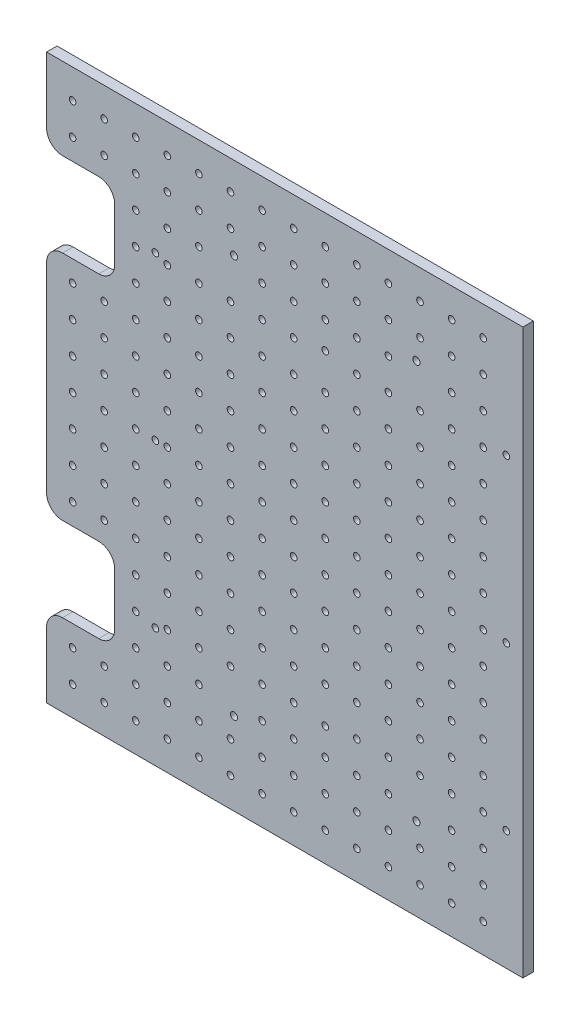
from build123d import *

# Parameters (mm, degrees)
SKETCH1_W                            = 287.27
SKETCH1_H                            = 340
BASE_PLATE_EXTRUDE_DEPTH             = 6.3
SKETCH3_R                            = 2
SKETCH3_R_2                          = 2.15
PLATE_TO_PLATE_MNT_THRU_HOLE_DEPTH   = 223.644791596
SKETCH4_R                            = 2
CENTER_PERFORATION_THRU_HOLE_DEPTH   = 223.644791596
SKETCH6_R                            = 2
EXTENDED_PERFORATION_THRU_HOLE_DEPTH = 223.644791596
CABLE_ROUTING_CUTOUT_DEPTH           = 223.644791596


with BuildPart() as part:
    # Sketch1 → Base_Plate-Extrude (new body)
    with BuildSketch(Plane.XY):
        Rectangle(SKETCH1_W, SKETCH1_H)
    extrude(amount=BASE_PLATE_EXTRUDE_DEPTH)

    # Sketch3 → Plate_to_Plate_Mnt-Thru-Hole (cut, through all)
    with BuildSketch(Plane.XY.offset(6.3)):
        with Locations((133.635, 98)):
            Circle(SKETCH3_R)
        with Locations((24.415, 98)):
            Circle(SKETCH3_R)
        with Locations((-78.025, 98)):
            Circle(SKETCH3_R)
        with Locations((-78.025, -98)):
            Circle(SKETCH3_R)
        with Locations((24.415, -98)):
            Circle(SKETCH3_R)
        with Locations((133.635, -98)):
            Circle(SKETCH3_R)
        with Locations((133.635, 0)):
            Circle(SKETCH3_R)
        with Locations((-78.025, 0)):
            Circle(SKETCH3_R)
        with Locations((79.415, -120.25)):
            Circle(SKETCH3_R_2)
        with Locations((-30.585, -120.25)):
            Circle(SKETCH3_R_2)
        with Locations((-30.585, 120.25)):
            Circle(SKETCH3_R_2)
        with Locations((79.415, 120.25)):
            Circle(SKETCH3_R_2)
    extrude(amount=-PLATE_TO_PLATE_MNT_THRU_HOLE_DEPTH, mode=Mode.SUBTRACT)

    # Sketch4 → Center_Perforation-Thru-Hole (cut, through all)
    with BuildSketch(Plane.XY.offset(6.3)):
        with Locations((-70.835, 0)):
            Circle(SKETCH4_R)
        with Locations((-51.785, 0)):
            Circle(SKETCH4_R)
        with Locations((-32.735, 0)):
            Circle(SKETCH4_R)
        with Locations((-13.685, 0)):
            Circle(SKETCH4_R)
        with Locations((5.365, 0)):
            Circle(SKETCH4_R)
        with Locations((24.415, 0)):
            Circle(SKETCH4_R)
        with Locations((43.465, 0)):
            Circle(SKETCH4_R)
        with Locations((62.515, 0)):
            Circle(SKETCH4_R)
        with Locations((81.565, 0)):
            Circle(SKETCH4_R)
        with Locations((100.615, 0)):
            Circle(SKETCH4_R)
        with Locations((119.665, 0)):
            Circle(SKETCH4_R)
        with Locations((-70.835, 19.05)):
            Circle(SKETCH4_R)
        with Locations((-51.785, 19.05)):
            Circle(SKETCH4_R)
        with Locations((-32.735, 19.05)):
            Circle(SKETCH4_R)
        with Locations((-13.685, 19.05)):
            Circle(SKETCH4_R)
        with Locations((5.365, 19.05)):
            Circle(SKETCH4_R)
        with Locations((24.415, 19.05)):
            Circle(SKETCH4_R)
        with Locations((43.465, 19.05)):
            Circle(SKETCH4_R)
        with Locations((62.515, 19.05)):
            Circle(SKETCH4_R)
        with Locations((81.565, 19.05)):
            Circle(SKETCH4_R)
        with Locations((100.615, 19.05)):
            Circle(SKETCH4_R)
        with Locations((119.665, 19.05)):
            Circle(SKETCH4_R)
        with Locations((-70.835, 38.1)):
            Circle(SKETCH4_R)
        with Locations((-51.785, 38.1)):
            Circle(SKETCH4_R)
        with Locations((-32.735, 38.1)):
            Circle(SKETCH4_R)
        with Locations((-13.685, 38.1)):
            Circle(SKETCH4_R)
        with Locations((5.365, 38.1)):
            Circle(SKETCH4_R)
        with Locations((24.415, 38.1)):
            Circle(SKETCH4_R)
        with Locations((43.465, 38.1)):
            Circle(SKETCH4_R)
        with Locations((62.515, 38.1)):
            Circle(SKETCH4_R)
        with Locations((81.565, 38.1)):
            Circle(SKETCH4_R)
        with Locations((100.615, 38.1)):
            Circle(SKETCH4_R)
        with Locations((119.665, 38.1)):
            Circle(SKETCH4_R)
        with Locations((-70.835, 57.15)):
            Circle(SKETCH4_R)
        with Locations((-51.785, 57.15)):
            Circle(SKETCH4_R)
        with Locations((-32.735, 57.15)):
            Circle(SKETCH4_R)
        with Locations((-13.685, 57.15)):
            Circle(SKETCH4_R)
        with Locations((5.365, 57.15)):
            Circle(SKETCH4_R)
        with Locations((24.415, 57.15)):
            Circle(SKETCH4_R)
        with Locations((43.465, 57.15)):
            Circle(SKETCH4_R)
        with Locations((62.515, 57.15)):
            Circle(SKETCH4_R)
        with Locations((81.565, 57.15)):
            Circle(SKETCH4_R)
        with Locations((100.615, 57.15)):
            Circle(SKETCH4_R)
        with Locations((119.665, 57.15)):
            Circle(SKETCH4_R)
        with Locations((-70.835, -19.05)):
            Circle(SKETCH4_R)
        with Locations((-51.785, -19.05)):
            Circle(SKETCH4_R)
        with Locations((-32.735, -19.05)):
            Circle(SKETCH4_R)
        with Locations((-13.685, -19.05)):
            Circle(SKETCH4_R)
        with Locations((5.365, -19.05)):
            Circle(SKETCH4_R)
        with Locations((24.415, -19.05)):
            Circle(SKETCH4_R)
        with Locations((43.465, -19.05)):
            Circle(SKETCH4_R)
        with Locations((62.515, -19.05)):
            Circle(SKETCH4_R)
        with Locations((81.565, -19.05)):
            Circle(SKETCH4_R)
        with Locations((100.615, -19.05)):
            Circle(SKETCH4_R)
        with Locations((119.665, -19.05)):
            Circle(SKETCH4_R)
        with Locations((-70.835, -38.1)):
            Circle(SKETCH4_R)
        with Locations((-51.785, -38.1)):
            Circle(SKETCH4_R)
        with Locations((-32.735, -38.1)):
            Circle(SKETCH4_R)
        with Locations((-13.685, -38.1)):
            Circle(SKETCH4_R)
        with Locations((5.365, -38.1)):
            Circle(SKETCH4_R)
        with Locations((24.415, -38.1)):
            Circle(SKETCH4_R)
        with Locations((43.465, -38.1)):
            Circle(SKETCH4_R)
        with Locations((62.515, -38.1)):
            Circle(SKETCH4_R)
        with Locations((81.565, -38.1)):
            Circle(SKETCH4_R)
        with Locations((100.615, -38.1)):
            Circle(SKETCH4_R)
        with Locations((119.665, -38.1)):
            Circle(SKETCH4_R)
        with Locations((-70.835, -57.15)):
            Circle(SKETCH4_R)
        with Locations((-51.785, -57.15)):
            Circle(SKETCH4_R)
        with Locations((-32.735, -57.15)):
            Circle(SKETCH4_R)
        with Locations((-13.685, -57.15)):
            Circle(SKETCH4_R)
        with Locations((5.365, -57.15)):
            Circle(SKETCH4_R)
        with Locations((24.415, -57.15)):
            Circle(SKETCH4_R)
        with Locations((43.465, -57.15)):
            Circle(SKETCH4_R)
        with Locations((62.515, -57.15)):
            Circle(SKETCH4_R)
        with Locations((81.565, -57.15)):
            Circle(SKETCH4_R)
        with Locations((100.615, -57.15)):
            Circle(SKETCH4_R)
        with Locations((119.665, -57.15)):
            Circle(SKETCH4_R)
    extrude(amount=-CENTER_PERFORATION_THRU_HOLE_DEPTH, mode=Mode.SUBTRACT)

    # Sketch6 → Extended_Perforation-Thru-Hole (cut, through all)
    with BuildSketch(Plane.XY.offset(6.3)):
        with Locations((-89.885, 0)):
            Circle(SKETCH6_R)
        with Locations((-51.785, -95.25)):
            Circle(SKETCH6_R)
        with Locations((-70.835, -95.25)):
            Circle(SKETCH6_R)
        with Locations((-108.935, 0)):
            Circle(SKETCH6_R)
        with Locations((-127.985, 0)):
            Circle(SKETCH6_R)
        with Locations((-89.885, 19.05)):
            Circle(SKETCH6_R)
        with Locations((-108.935, 19.05)):
            Circle(SKETCH6_R)
        with Locations((-127.985, 19.05)):
            Circle(SKETCH6_R)
        with Locations((-89.885, 38.1)):
            Circle(SKETCH6_R)
        with Locations((-108.935, 38.1)):
            Circle(SKETCH6_R)
        with Locations((-127.985, 38.1)):
            Circle(SKETCH6_R)
        with Locations((-89.885, 57.15)):
            Circle(SKETCH6_R)
        with Locations((-108.935, 57.15)):
            Circle(SKETCH6_R)
        with Locations((-127.985, 57.15)):
            Circle(SKETCH6_R)
        with Locations((-89.885, 76.2)):
            Circle(SKETCH6_R)
        with Locations((-108.935, 76.2)):
            Circle(SKETCH6_R)
        with Locations((-127.985, 76.2)):
            Circle(SKETCH6_R)
        with Locations((-89.885, 95.25)):
            Circle(SKETCH6_R)
        with Locations((-108.935, 95.25)):
            Circle(SKETCH6_R)
        with Locations((-127.985, 95.25)):
            Circle(SKETCH6_R)
        with Locations((-89.885, 114.3)):
            Circle(SKETCH6_R)
        with Locations((-108.935, 114.3)):
            Circle(SKETCH6_R)
        with Locations((-127.985, 114.3)):
            Circle(SKETCH6_R)
        with Locations((-89.885, 133.35)):
            Circle(SKETCH6_R)
        with Locations((-108.935, 133.35)):
            Circle(SKETCH6_R)
        with Locations((-127.985, 133.35)):
            Circle(SKETCH6_R)
        with Locations((-89.885, 152.4)):
            Circle(SKETCH6_R)
        with Locations((-108.935, 152.4)):
            Circle(SKETCH6_R)
        with Locations((-127.985, 152.4)):
            Circle(SKETCH6_R)
        with Locations((-89.885, -19.05)):
            Circle(SKETCH6_R)
        with Locations((-108.935, -19.05)):
            Circle(SKETCH6_R)
        with Locations((-127.985, -19.05)):
            Circle(SKETCH6_R)
        with Locations((-89.885, -38.1)):
            Circle(SKETCH6_R)
        with Locations((-108.935, -38.1)):
            Circle(SKETCH6_R)
        with Locations((-127.985, -38.1)):
            Circle(SKETCH6_R)
        with Locations((-89.885, -57.15)):
            Circle(SKETCH6_R)
        with Locations((-108.935, -57.15)):
            Circle(SKETCH6_R)
        with Locations((-127.985, -57.15)):
            Circle(SKETCH6_R)
        with Locations((-89.885, -76.2)):
            Circle(SKETCH6_R)
        with Locations((-108.935, -76.2)):
            Circle(SKETCH6_R)
        with Locations((-127.985, -76.2)):
            Circle(SKETCH6_R)
        with Locations((-89.885, -95.25)):
            Circle(SKETCH6_R)
        with Locations((-108.935, -95.25)):
            Circle(SKETCH6_R)
        with Locations((-127.985, -95.25)):
            Circle(SKETCH6_R)
        with Locations((-89.885, -114.3)):
            Circle(SKETCH6_R)
        with Locations((-108.935, -114.3)):
            Circle(SKETCH6_R)
        with Locations((-127.985, -114.3)):
            Circle(SKETCH6_R)
        with Locations((-89.885, -133.35)):
            Circle(SKETCH6_R)
        with Locations((-108.935, -133.35)):
            Circle(SKETCH6_R)
        with Locations((-127.985, -133.35)):
            Circle(SKETCH6_R)
        with Locations((-89.885, -152.4)):
            Circle(SKETCH6_R)
        with Locations((-108.935, -152.4)):
            Circle(SKETCH6_R)
        with Locations((-127.985, -152.4)):
            Circle(SKETCH6_R)
        with Locations((-51.785, -114.3)):
            Circle(SKETCH6_R)
        with Locations((-70.835, -114.3)):
            Circle(SKETCH6_R)
        with Locations((119.665, -76.2)):
            Circle(SKETCH6_R)
        with Locations((100.615, -76.2)):
            Circle(SKETCH6_R)
        with Locations((119.665, -95.25)):
            Circle(SKETCH6_R)
        with Locations((100.615, -95.25)):
            Circle(SKETCH6_R)
        with Locations((119.665, -114.3)):
            Circle(SKETCH6_R)
        with Locations((100.615, -114.3)):
            Circle(SKETCH6_R)
        with Locations((119.665, -133.35)):
            Circle(SKETCH6_R)
        with Locations((100.615, -133.35)):
            Circle(SKETCH6_R)
        with Locations((119.665, -152.4)):
            Circle(SKETCH6_R)
        with Locations((100.615, -152.4)):
            Circle(SKETCH6_R)
        with Locations((-51.785, -133.35)):
            Circle(SKETCH6_R)
        with Locations((119.665, 76.2)):
            Circle(SKETCH6_R)
        with Locations((100.615, 76.2)):
            Circle(SKETCH6_R)
        with Locations((119.665, 95.25)):
            Circle(SKETCH6_R)
        with Locations((100.615, 95.25)):
            Circle(SKETCH6_R)
        with Locations((119.665, 114.3)):
            Circle(SKETCH6_R)
        with Locations((100.615, 114.3)):
            Circle(SKETCH6_R)
        with Locations((119.665, 133.35)):
            Circle(SKETCH6_R)
        with Locations((100.615, 133.35)):
            Circle(SKETCH6_R)
        with Locations((119.665, 152.4)):
            Circle(SKETCH6_R)
        with Locations((100.615, 152.4)):
            Circle(SKETCH6_R)
        with Locations((-70.835, 76.2)):
            Circle(SKETCH6_R)
        with Locations((-51.785, 76.2)):
            Circle(SKETCH6_R)
        with Locations((-70.835, -76.2)):
            Circle(SKETCH6_R)
        with Locations((-51.785, -76.2)):
            Circle(SKETCH6_R)
        with Locations((-51.785, 95.25)):
            Circle(SKETCH6_R)
        with Locations((-70.835, 95.25)):
            Circle(SKETCH6_R)
        with Locations((-51.785, 114.3)):
            Circle(SKETCH6_R)
        with Locations((-70.835, 114.3)):
            Circle(SKETCH6_R)
        with Locations((-51.785, 133.35)):
            Circle(SKETCH6_R)
        with Locations((-70.835, 133.35)):
            Circle(SKETCH6_R)
        with Locations((-51.785, 152.4)):
            Circle(SKETCH6_R)
        with Locations((-70.835, 152.4)):
            Circle(SKETCH6_R)
        with Locations((-70.835, -133.35)):
            Circle(SKETCH6_R)
        with Locations((-51.785, -152.4)):
            Circle(SKETCH6_R)
        with Locations((-70.835, -152.4)):
            Circle(SKETCH6_R)
        with Locations((62.515, -152.4)):
            Circle(SKETCH6_R)
        with Locations((81.565, -76.2)):
            Circle(SKETCH6_R)
        with Locations((81.565, -152.4)):
            Circle(SKETCH6_R)
        with Locations((81.565, 76.2)):
            Circle(SKETCH6_R)
        with Locations((81.565, 152.4)):
            Circle(SKETCH6_R)
        with Locations((62.515, -76.2)):
            Circle(SKETCH6_R)
        with Locations((62.515, 76.2)):
            Circle(SKETCH6_R)
        with Locations((62.515, 152.4)):
            Circle(SKETCH6_R)
        with Locations((43.465, -152.4)):
            Circle(SKETCH6_R)
        with Locations((43.465, -76.2)):
            Circle(SKETCH6_R)
        with Locations((43.465, 76.2)):
            Circle(SKETCH6_R)
        with Locations((43.465, 152.4)):
            Circle(SKETCH6_R)
        with Locations((24.415, -152.4)):
            Circle(SKETCH6_R)
        with Locations((24.415, -76.2)):
            Circle(SKETCH6_R)
        with Locations((24.415, 76.2)):
            Circle(SKETCH6_R)
        with Locations((24.415, 152.4)):
            Circle(SKETCH6_R)
        with Locations((5.365, -152.4)):
            Circle(SKETCH6_R)
        with Locations((5.365, -76.2)):
            Circle(SKETCH6_R)
        with Locations((5.365, 76.2)):
            Circle(SKETCH6_R)
        with Locations((5.365, 152.4)):
            Circle(SKETCH6_R)
        with Locations((-13.685, -152.4)):
            Circle(SKETCH6_R)
        with Locations((-13.685, -76.2)):
            Circle(SKETCH6_R)
        with Locations((-13.685, 76.2)):
            Circle(SKETCH6_R)
        with Locations((-13.685, 152.4)):
            Circle(SKETCH6_R)
        with Locations((-32.735, -152.4)):
            Circle(SKETCH6_R)
        with Locations((-32.735, -76.2)):
            Circle(SKETCH6_R)
        with Locations((-32.735, 76.2)):
            Circle(SKETCH6_R)
        with Locations((-32.735, 152.4)):
            Circle(SKETCH6_R)
        with Locations((81.565, -133.35)):
            Circle(SKETCH6_R)
        with Locations((-32.735, -133.35)):
            Circle(SKETCH6_R)
        with Locations((5.365, -95.25)):
            Circle(SKETCH6_R)
        with Locations((-13.685, -95.25)):
            Circle(SKETCH6_R)
        with Locations((-32.735, -95.25)):
            Circle(SKETCH6_R)
        with Locations((81.565, -95.25)):
            Circle(SKETCH6_R)
        with Locations((62.515, -95.25)):
            Circle(SKETCH6_R)
        with Locations((43.465, -95.25)):
            Circle(SKETCH6_R)
        with Locations((-32.735, 95.25)):
            Circle(SKETCH6_R)
        with Locations((-13.685, 95.25)):
            Circle(SKETCH6_R)
        with Locations((5.365, 95.25)):
            Circle(SKETCH6_R)
        with Locations((43.465, 95.25)):
            Circle(SKETCH6_R)
        with Locations((62.515, 95.25)):
            Circle(SKETCH6_R)
        with Locations((81.565, 95.25)):
            Circle(SKETCH6_R)
        with Locations((62.515, 133.35)):
            Circle(SKETCH6_R)
        with Locations((43.465, 133.35)):
            Circle(SKETCH6_R)
        with Locations((24.415, 133.35)):
            Circle(SKETCH6_R)
        with Locations((5.365, 133.35)):
            Circle(SKETCH6_R)
        with Locations((-13.685, 133.35)):
            Circle(SKETCH6_R)
        with Locations((62.515, 114.3)):
            Circle(SKETCH6_R)
        with Locations((43.465, 114.3)):
            Circle(SKETCH6_R)
        with Locations((24.415, 114.3)):
            Circle(SKETCH6_R)
        with Locations((5.365, 114.3)):
            Circle(SKETCH6_R)
        with Locations((-13.685, 114.3)):
            Circle(SKETCH6_R)
        with Locations((62.515, -133.35)):
            Circle(SKETCH6_R)
        with Locations((43.465, -133.35)):
            Circle(SKETCH6_R)
        with Locations((24.415, -133.35)):
            Circle(SKETCH6_R)
        with Locations((5.365, -133.35)):
            Circle(SKETCH6_R)
        with Locations((-13.685, -133.35)):
            Circle(SKETCH6_R)
        with Locations((62.515, -114.3)):
            Circle(SKETCH6_R)
        with Locations((43.465, -114.3)):
            Circle(SKETCH6_R)
        with Locations((24.415, -114.3)):
            Circle(SKETCH6_R)
        with Locations((5.365, -114.3)):
            Circle(SKETCH6_R)
        with Locations((-13.685, -114.3)):
            Circle(SKETCH6_R)
        with Locations((81.565, 133.35)):
            Circle(SKETCH6_R)
        with Locations((-32.735, 133.35)):
            Circle(SKETCH6_R)
    extrude(amount=-EXTENDED_PERFORATION_THRU_HOLE_DEPTH, mode=Mode.SUBTRACT)

    # Sketch10 → Cable_Routing-Cutout (cut, through all)
    with BuildSketch(Plane(origin=(0, 0, 0), x_dir=(-1, 0, 0), z_dir=(0, 0, -1))):
        with BuildLine():
            Line((134.035, -69.85), (112.185, -69.85))
            ThreePointArc((112.185, -69.85), (105.396774901, -72.661774901), (102.585, -79.45))
            Line((102.585, -79.45), (102.585, -111.05))
            ThreePointArc((102.585, -111.05), (105.396774901, -117.838225099), (112.185, -120.65))
            Line((112.185, -120.65), (134.035, -120.65))
            ThreePointArc((134.035, -120.65), (140.823225099, -123.461774901), (143.635, -130.25))
            Line((143.635, -130.25), (143.635, -60.25))
            ThreePointArc((143.635, -60.25), (140.823225099, -67.038225099), (134.035, -69.85))
        make_face()
        with BuildLine():
            Line((143.635, 130.25), (143.635, 60.25))
            ThreePointArc((143.635, 60.25), (140.823225099, 67.038225099), (134.035, 69.85))
            Line((134.035, 69.85), (112.185, 69.85))
            ThreePointArc((112.185, 69.85), (105.396774901, 72.661774901), (102.585, 79.45))
            Line((102.585, 79.45), (102.585, 111.05))
            ThreePointArc((102.585, 111.05), (105.396774901, 117.838225099), (112.185, 120.65))
            Line((112.185, 120.65), (134.035, 120.65))
            ThreePointArc((134.035, 120.65), (140.823225099, 123.461774901), (143.635, 130.25))
        make_face()
    extrude(amount=-CABLE_ROUTING_CUTOUT_DEPTH, mode=Mode.SUBTRACT)


solid = part.part
